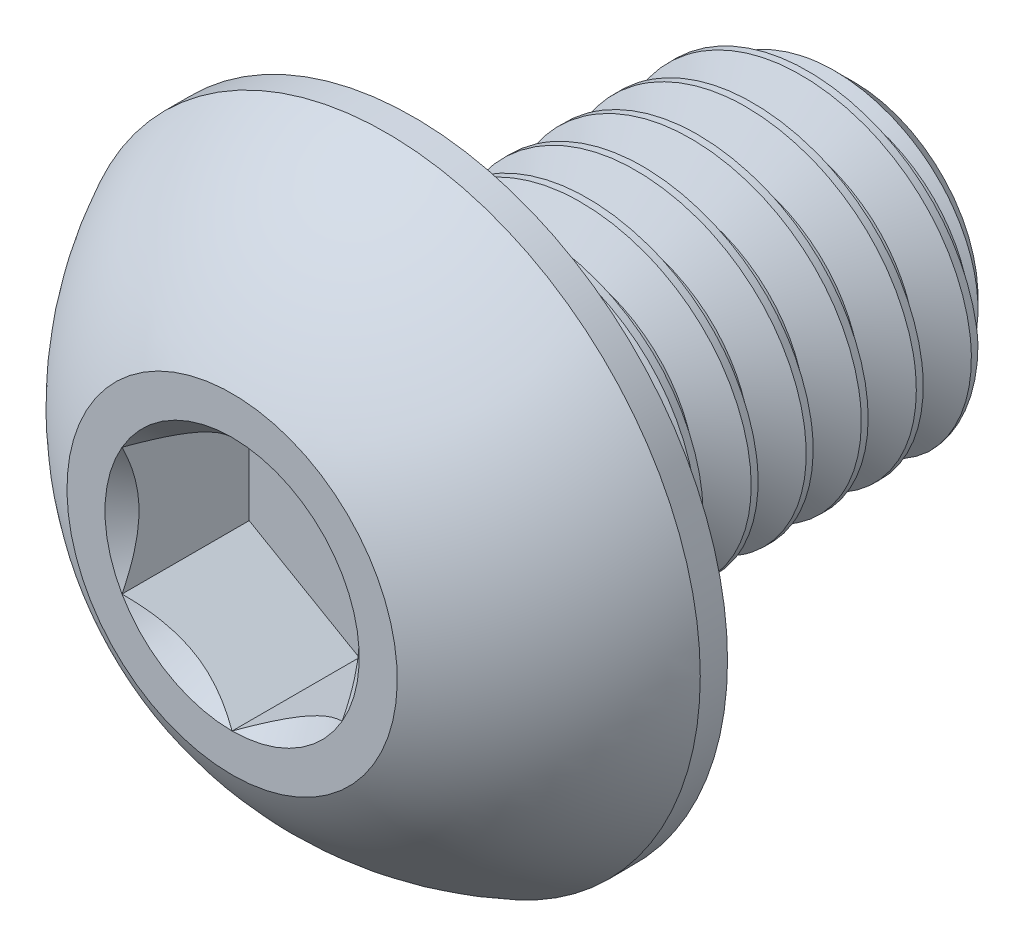
from build123d import *

# Parameters (mm, degrees)
SKETCH1_W          = 4
SKETCH1_H          = 1.5
CHAMFER1_SIZE      = 0.375
CUT_SWEEP1_PITCH   = 0.5
CUT_EXTRUDE2_DEPTH = 1.155


with BuildPart() as part:
    # Sketch1 → Revolve1 (revolve)
    with BuildSketch(Plane(origin=(0, 0, 0), x_dir=(0, 0, -1), z_dir=(1, 0, 0))):
        with Locations((3.65, 0.75)):
            Rectangle(SKETCH1_W, SKETCH1_H)
    revolve(axis=Axis((0, 0, -5.65), (0, 0, 1)))

    # Chamfer1
    chamfer1_edges = [part.edges().sort_by_distance(p)[0] for p in [
        (0, -1.5, -5.65),
    ]]
    chamfer(chamfer1_edges, length=CHAMFER1_SIZE)

    # Cut-Sweep1: the profile of Sketch2 profile screwed along a right-hand helix of 9 turns, 6 arcs to a turn; built about Z, then put on its axis
    cut_sweep1_z = Axis((0, 0, 0), (0, 0, 1))
    cut_sweep1_corners = [(1.5003, 0, 0.000173205), (1.5003, 0, -0.437673205), (1.175240474, 0, -0.25), (1.175240474, 0, -0.1875)]
    with BuildLine(mode=Mode.PRIVATE) as cut_sweep1_profile:
        Line(cut_sweep1_corners[0], cut_sweep1_corners[1])
        Line(cut_sweep1_corners[1], cut_sweep1_corners[2])
        Line(cut_sweep1_corners[2], cut_sweep1_corners[3])
        Line(cut_sweep1_corners[3], cut_sweep1_corners[0])
    cut_sweep1_cap = Face(cut_sweep1_profile.wire())
    cut_sweep1_turn_angles = [0, 30, 60, 90, 120, 150, 180, 210, 240, 270, 300, 330, 360]
    cut_sweep1_turn_weights = [1, 0.8660254037844387, 1, 0.8660254037844387, 1, 0.8660254037844387, 1, 0.8660254037844387, 1, 0.8660254037844387, 1, 0.8660254037844387, 1]
    cut_sweep1_turn_rails = [Edge.make_bspline([Vector(p[0], p[1], 0).rotate(cut_sweep1_z, cut_sweep1_turn_angles[k]) / cut_sweep1_turn_weights[k] + Vector(0, 0, p[2] + CUT_SWEEP1_PITCH * cut_sweep1_turn_angles[k] / 360) for k in range(13)], [0, 0, 0, 1, 1, 2, 2, 3, 3, 4, 4, 5, 5, 6, 6, 6], 2, cut_sweep1_turn_weights) for p in cut_sweep1_corners]
    cut_sweep1_turn_sides = [Face.make_surface_from_curves(cut_sweep1_turn_rails[p[0]], cut_sweep1_turn_rails[p[1]]) for p in [(0, 1), (1, 2), (2, 3), (3, 0)]]
    cut_sweep1 = Plane(origin=(0, 0, -5.65), x_dir=(0, 1, 0), z_dir=(0, 0, 1)) * Solid(Shell([*[p.moved(Location((0, 0, CUT_SWEEP1_PITCH * i))) for i in range(9) for p in cut_sweep1_turn_sides], cut_sweep1_cap, cut_sweep1_cap.rotate(cut_sweep1_z, 3240).moved(Location((0, 0, CUT_SWEEP1_PITCH * 3240 / 360)))]))
    add(cut_sweep1, mode=Mode.SUBTRACT)

    # Sketch7 → Revolve2 (revolve)
    with BuildSketch(Plane(origin=(0, 0, 0), x_dir=(0, 0, -1), z_dir=(1, 0, 0)), mode=Mode.PRIVATE) as revolve2_sk:
        with BuildLine():
            Line((1.4025, 2.85), (1.65, 2.85))
            Line((1.65, 2.85), (1.65, 0))
            Line((1.65, 0), (0, 0))
            Line((0, 0), (0, 1.5))
            ThreePointArc((0, 1.5), (0.59512511, 2.285251969), (1.4025, 2.85))
        make_face()
    revolve(revolve2_sk.sketch.rotate(Axis((0, 0, 0), (0, 0, -1)), 189.336081704), axis=Axis((0, 0, 0), (0, 0, -1)))

    # Sketch5 → Cut-Extrude2 (cut)
    with BuildSketch(Plane.XY):
        Polygon((1, -0.577350269), (1, 0.577350269), (0, 1.154700538), (-1, 0.577350269), (-1, -0.577350269), (0, -1.154700538), align=None)
    extrude(amount=-CUT_EXTRUDE2_DEPTH, mode=Mode.SUBTRACT)

    # Cut-Extrude3 cone 1 section (through the dimple's axis) → Cut-Extrude3 (revolve, cut)
    with BuildSketch(Plane(origin=(0, 0, 0), x_dir=(0, -1, 0), z_dir=(1, 0, 0))):
        Polygon((0, 0), (1.154700538, 0), (0, 1.154700538), align=None)
    revolve(axis=Axis((0, 0, 0), (0, 0, -1)), mode=Mode.SUBTRACT)


solid = part.part
